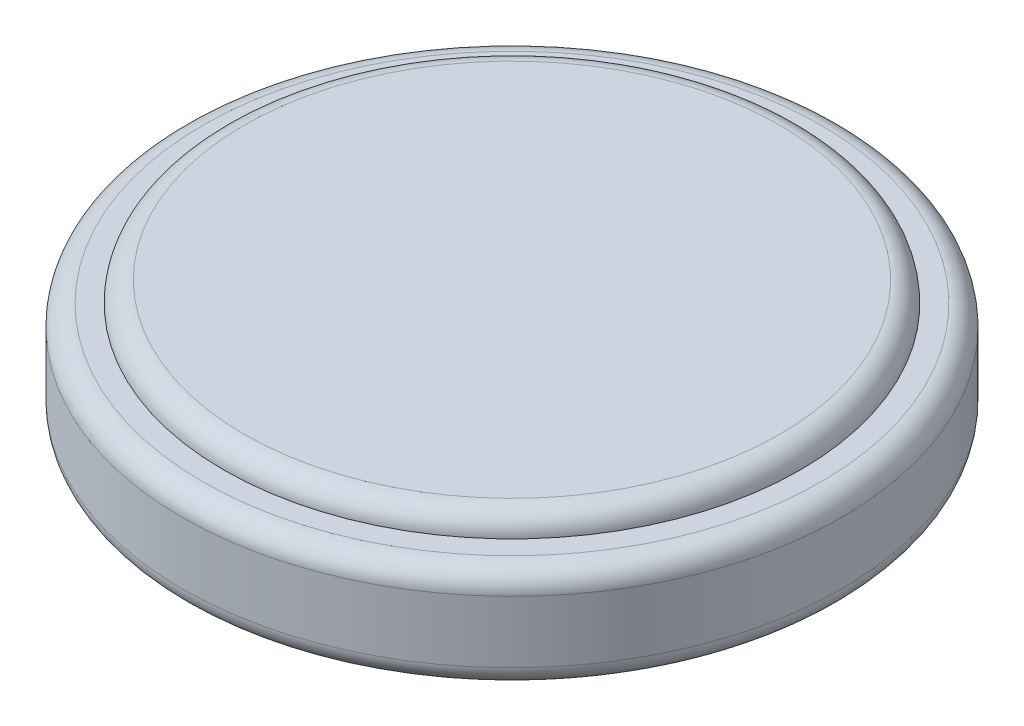
from build123d import *

# Parameters (mm, degrees)
SKETCH1_R           = 8
BOSS_EXTRUDE1_DEPTH = 2.5
SKETCH2_R           = 7
BOSS_EXTRUDE2_DEPTH = 0.5
FILLET1_R           = 0.5


with BuildPart() as part:
    # Sketch1 → Boss-Extrude1 (new body)
    with BuildSketch(Plane(origin=(0, 0, 0), x_dir=(1, 0, 0), z_dir=(0, 1, 0))):
        with Locations(Location((0, 0, 0), (0, 0, 270))):
            Circle(SKETCH1_R)
    extrude(amount=BOSS_EXTRUDE1_DEPTH)

    # Sketch2 → Boss-Extrude2 (add)
    with BuildSketch(Plane(origin=(0, 2.5, 0), x_dir=(1, 0, 0), z_dir=(0, 1, 0))):
        with Locations(Location((0, 0, 0), (0, 0, 270))):
            Circle(SKETCH2_R)
    extrude(amount=BOSS_EXTRUDE2_DEPTH)

    # Fillet1
    fillet1_edges = [part.edges().sort_by_distance(p)[0] for p in [
        (0, 0, -8),
        (0, 2.5, -8),
        (0, 3, -7),
    ]]
    fillet(fillet1_edges, radius=FILLET1_R - 0.0001)  # a hair under: the kernel refuses the full size


solid = part.part
